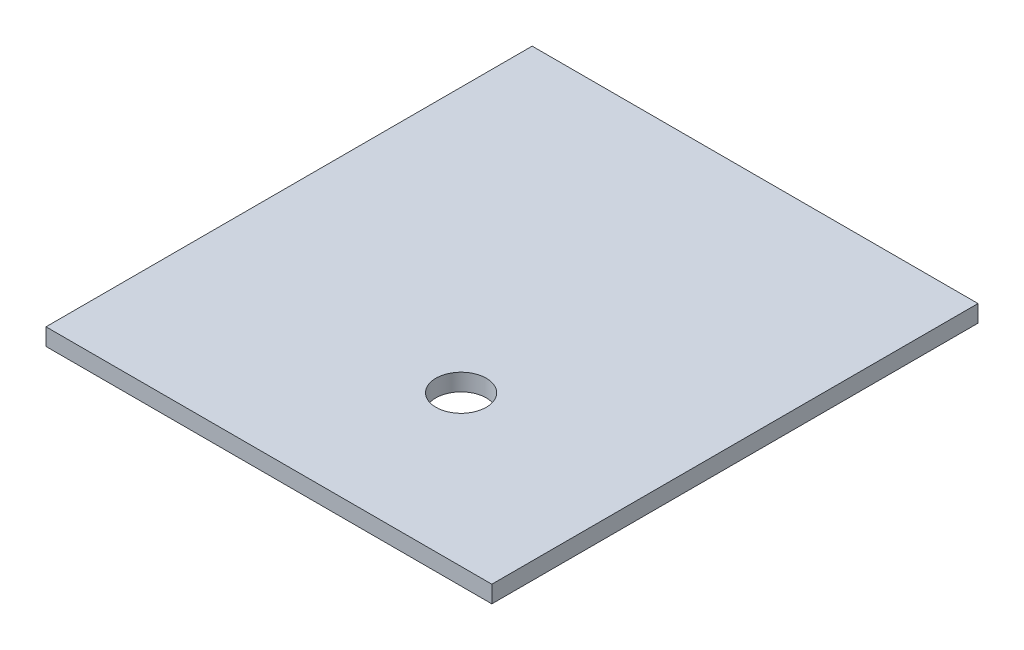
from build123d import *

# Parameters (mm, degrees)
SKETCH1_W           = 146.05
SKETCH1_H           = 159.258
BOSS_EXTRUDE1_DEPTH = 5.588
CUT_EXTRUDE1_REACH  = 110.188
SKETCH4_R           = 8.255


with BuildPart() as part:
    # Sketch1 → Boss-Extrude1 (new body)
    with BuildSketch(Plane(origin=(0, 0, 0), x_dir=(1, 0, 0), z_dir=(0, 1, 0))):
        Rectangle(SKETCH1_W, SKETCH1_H)
    extrude(amount=BOSS_EXTRUDE1_DEPTH)

    # Sketch4 → Cut-Extrude1 (cut, up to next)
    with BuildSketch(Plane(origin=(0, 5.588, 0), x_dir=(1, 0, 0), z_dir=(0, 1, 0)), mode=Mode.PRIVATE) as cut_extrude1_sk1:
        with Locations((13.670647071, -30.353)):
            Circle(SKETCH4_R)
    cut_extrude1_tool1 = extrude(cut_extrude1_sk1.sketch, amount=-CUT_EXTRUDE1_REACH, mode=Mode.PRIVATE) & part.part
    add(cut_extrude1_tool1.solids().sort_by_distance((13.670647, 5.588, 30.353))[0], mode=Mode.SUBTRACT)


solid = part.part
